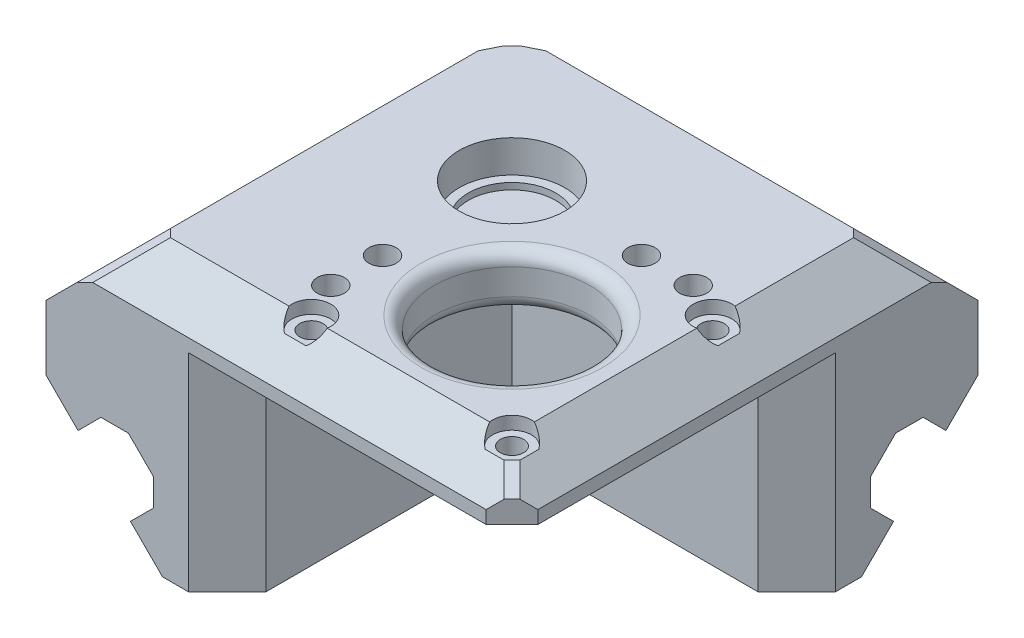
from build123d import *

# Parameters (mm, degrees)
SKETCH1_W           = 72
SKETCH1_H           = 72
SKETCH1_R           = 12
SKETCH1_R_2         = 1.8
BOSS_EXTRUDE1_DEPTH = 40
SKETCH6_W           = 44
SKETCH6_H           = 44
CUT_EXTRUDE1_DEPTH  = 32
CHAMFER1_SIZE       = 18
SKETCH7_W           = 18
SKETCH7_H           = 18
CUT_EXTRUDE2_DEPTH  = 65.745656225
CHAMFER2_SIZE       = 8
CHAMFER3_SIZE       = 4
SKETCH8_R           = 3
CUT_EXTRUDE3_DEPTH  = 2
CHAMFER5_SIZE       = 6
CHAMFER6_SIZE       = 6
CHAMFER7_SIZE       = 12
SKETCH9_R           = 2.1
CUT_EXTRUDE4_DEPTH  = 6
SKETCH10_R          = 2.1
CUT_EXTRUDE5_DEPTH  = 6
SKETCH11_R          = 8.15
CUT_EXTRUDE6_DEPTH  = 5
FILLET1_R           = 2
SKETCH13_R          = 6.75
CUT_EXTRUDE7_DEPTH  = 1
SKETCH15_R          = 2.1
CUT_EXTRUDE8_DEPTH  = 6
CHAMFER8_SIZE       = 1
SKETCH16_W          = 11.455844123
SKETCH16_H          = 76.568397014
CUT_EXTRUDE9_DEPTH  = 8
SKETCH17_W          = 86.001258557
SKETCH17_H          = 11.455844123
CUT_EXTRUDE10_DEPTH = 8
CHAMFER9_SIZE       = 3


with BuildPart() as part:
    # Sketch1 → Boss-Extrude1 (new body)
    with BuildSketch(Plane(origin=(0, 0, 0), x_dir=(1, 0, 0), z_dir=(0, 1, 0))):
        Rectangle(SKETCH1_W, SKETCH1_H)
        with Locations(Location((14, -14, 0), (0, 0, 270))):
            Circle(SKETCH1_R, mode=Mode.SUBTRACT)
        with Locations(Location((29.5, 1.5, 0), (0, 0, 270))):
            Circle(SKETCH1_R_2, mode=Mode.SUBTRACT)
        with Locations(Location((29.5, -29.5, 0), (0, 0, 270))):
            Circle(SKETCH1_R_2, mode=Mode.SUBTRACT)
        with Locations(Location((-1.5, -29.5, 0), (0, 0, 270))):
            Circle(SKETCH1_R_2, mode=Mode.SUBTRACT)
        with Locations(Location((-1.5, 1.5, 0), (0, 0, 270))):
            Circle(SKETCH1_R_2, mode=Mode.SUBTRACT)
    extrude(amount=BOSS_EXTRUDE1_DEPTH)

    # Sketch6 → Cut-Extrude1 (cut)
    with BuildSketch(Plane(origin=(0, 0, 0), x_dir=(-1, 0, 0), z_dir=(0, -1, 0))):
        with Locations((-14, -14)):
            Rectangle(SKETCH6_W, SKETCH6_H)
    extrude(amount=-CUT_EXTRUDE1_DEPTH, mode=Mode.SUBTRACT)

    # Chamfer1
    chamfer1_edges = [part.edges().sort_by_distance(p)[0] for p in [
        (-36, 0, 0),
        (0, 0, -36),
        (-36, 20, -36),
    ]]
    chamfer(chamfer1_edges, length=CHAMFER1_SIZE)

    # Sketch7 → Cut-Extrude2 (cut, through all)
    with BuildSketch(Plane(origin=(0, 40, 0), x_dir=(1, 0, 0), z_dir=(0, 1, 0))):
        with Locations((-27, 27)):
            Rectangle(SKETCH7_W, SKETCH7_H)
    extrude(amount=-CUT_EXTRUDE2_DEPTH, mode=Mode.SUBTRACT)

    # Chamfer2
    # the kernel refuses this chamfer: 8 mm, written as the material it adds along each edge
    with BuildSketch(Plane(origin=(-18, 40, -18), x_dir=(0.027495876610586487, 0, -0.9996219169112968), z_dir=(0, -1, 0))) as chamfer2_piece_1_section:
        Polygon((CHAMFER2_SIZE * 0.999621916911, -CHAMFER2_SIZE * 0.0274958766106), (-CHAMFER2_SIZE * 0.0274958766106, -CHAMFER2_SIZE * 0.999621916911), (0, 0), align=None)
    chamfer2_piece_1 = extrude(amount=60.573463904, mode=Mode.PRIVATE)
    chamfer2_piece_1 = split(chamfer2_piece_1, bisect_by=Plane(origin=(-20.597865647, 12.296786874, -30.296786874), z_dir=(0, 0.7071067811865476, 0.7071067811865476)), keep=Keep.TOP, mode=Mode.PRIVATE)
    chamfer2_piece_1 = split(chamfer2_piece_1, bisect_by=Plane(origin=(-30.296786874, 12.296786874, -20.597865647), z_dir=(0.7071067811865476, 0.7071067811865476, 0)), keep=Keep.TOP, mode=Mode.PRIVATE)
    add(chamfer2_piece_1)

    # Chamfer3
    chamfer3_edges = [part.edges().sort_by_distance(p)[0] for p in [
        (36, 36, 36),
    ]]
    chamfer(chamfer3_edges, length=CHAMFER3_SIZE)

    # Sketch8 → Cut-Extrude3 (cut)
    with BuildSketch(Plane(origin=(0, 40, 0), x_dir=(1, 0, 0), z_dir=(0, 1, 0))):
        with Locations(Location((-1.5, 1.5, 0), (0, 0, 270))):
            Circle(SKETCH8_R)
        with Locations(Location((29.5, 1.5, 0), (0, 0, 270))):
            Circle(SKETCH8_R)
        with Locations(Location((29.5, -29.5, 0), (0, 0, 270))):
            Circle(SKETCH8_R)
        with Locations(Location((-1.5, -29.5, 0), (0, 0, 270))):
            Circle(SKETCH8_R)
    extrude(amount=-CUT_EXTRUDE3_DEPTH, mode=Mode.SUBTRACT)

    # Chamfer5
    chamfer5_edges = [part.edges().sort_by_distance(p)[0] for p in [
        (36, 16, -8),
        (-8, 16, 36),
    ]]
    chamfer(chamfer5_edges, length=CHAMFER5_SIZE)

    # Chamfer6
    # the kernel refuses this chamfer: 6 mm, written as the material it takes off along each edge
    with BuildSketch(Plane(origin=(36, 40, -51.430097928), x_dir=(0.027495876610586768, -0.9996219169112968, 0), z_dir=(0, 0, 1)), Plane(origin=(47.430097928, 40, 36), x_dir=(0, -0.9996219169112965, 0.02749587661058676), z_dir=(-1, 0, 0))) as chamfer6_piece_1:
        Polygon((CHAMFER6_SIZE * 0.999621916911, -CHAMFER6_SIZE * 0.0274958766106), (-CHAMFER6_SIZE * 0.0274958766106, -CHAMFER6_SIZE * 0.999621916911), (0, 0), align=None)
    extrude(amount=98.860195856, mode=Mode.SUBTRACT)

    # Chamfer7
    chamfer7_edges = [part.edges().sort_by_distance(p)[0] for p in [
        (6, 40, -36),
        (-36, 40, 6),
    ]]
    chamfer(chamfer7_edges, length=CHAMFER7_SIZE)

    # Sketch9 → Cut-Extrude4 (cut)
    with BuildSketch(Plane(origin=(0, -9, -9), x_dir=(-1, 0, 0), z_dir=(0, -0.7071067811865488, -0.7071067811865464))):
        with Locations(Location((11.977430497, 15.455844123, 0), (0, 0, 90))):
            Circle(SKETCH9_R)
        with Locations(Location((-20.022569503, 15.455844123, 0), (0, 0, 90))):
            Circle(SKETCH9_R)
        with Locations(Location((-20.022569503, 35.455844123, 0), (0, 0, 90))):
            Circle(SKETCH9_R)
        with Locations(Location((11.977430497, 35.455844123, 0), (0, 0, 90))):
            Circle(SKETCH9_R)
    extrude(amount=-CUT_EXTRUDE4_DEPTH, mode=Mode.SUBTRACT)

    # Sketch10 → Cut-Extrude5 (cut)
    with BuildSketch(Plane(origin=(-9, -9, 0), x_dir=(-0.7071067811865488, 0.7071067811865464, 0), z_dir=(-0.7071067811865464, -0.7071067811865488, 0))):
        with Locations(Location((35.455844123, 12, 0), (0, 0, 180))):
            Circle(SKETCH10_R)
        with Locations(Location((35.455844123, -20, 0), (0, 0, 180))):
            Circle(SKETCH10_R)
        with Locations(Location((15.455844123, -20, 0), (0, 0, 180))):
            Circle(SKETCH10_R)
        with Locations(Location((15.455844123, 12, 0), (0, 0, 180))):
            Circle(SKETCH10_R)
    extrude(amount=-CUT_EXTRUDE5_DEPTH, mode=Mode.SUBTRACT)

    # Sketch11 → Cut-Extrude6 (cut)
    with BuildSketch(Plane(origin=(0, 40, 0), x_dir=(1, 0, 0), z_dir=(0, 1, 0))):
        with Locations(Location((-4, 4, 0), (0, 0, 270))):
            Circle(SKETCH11_R)
    extrude(amount=-CUT_EXTRUDE6_DEPTH, mode=Mode.SUBTRACT)

    # Fillet1
    fillet1_edges = [part.edges().sort_by_distance(p)[0] for p in [
        (14, 40, 2),
        (14, 32, 2),
    ]]
    fillet(fillet1_edges, radius=FILLET1_R)

    # Sketch13 → Cut-Extrude7 (cut)
    with BuildSketch(Plane(origin=(0, 35, 0), x_dir=(1, 0, 0), z_dir=(0, 1, 0))):
        with Locations(Location((-4, 4, 0), (0, 0, 270))):
            Circle(SKETCH13_R)
    extrude(amount=-CUT_EXTRUDE7_DEPTH, mode=Mode.SUBTRACT)

    # Sketch15 → Cut-Extrude8 (cut)
    with BuildSketch(Plane(origin=(0, 40, 0), x_dir=(1, 0, 0), z_dir=(0, 1, 0))):
        with Locations(Location((16, 4, 0), (0, 0, 270))):
            Circle(SKETCH15_R)
        with Locations(Location((24, 4, 0), (0, 0, 270))):
            Circle(SKETCH15_R)
        with Locations(Location((-4, -16, 0), (0, 0, 270))):
            Circle(SKETCH15_R)
        with Locations(Location((-4, -24, 0), (0, 0, 270))):
            Circle(SKETCH15_R)
    extrude(amount=-CUT_EXTRUDE8_DEPTH, mode=Mode.SUBTRACT)

    # Chamfer8
    chamfer8_edges = [part.edges().sort_by_distance(p)[0] for p in [
        (-25, 39, -19),
        (-19, 39, -25),
        (33, 37, -27),
        (32.810660172, 37.189339828, 32.810660172),
        (-27, 37, 33),
    ]]
    chamfer(chamfer8_edges, length=CHAMFER8_SIZE)

    # Sketch16 → Cut-Extrude9 (cut)
    with BuildSketch(Plane(origin=(-9, -9, 0), x_dir=(-0.7071067811865488, 0.7071067811865464, 0), z_dir=(-0.7071067811865464, -0.7071067811865488, 0))):
        with Locations((25.455844123, 2.284198507)):
            Rectangle(SKETCH16_W, SKETCH16_H)
    extrude(amount=-CUT_EXTRUDE9_DEPTH, mode=Mode.SUBTRACT)

    # Sketch17 → Cut-Extrude10 (cut)
    with BuildSketch(Plane(origin=(0, -9, -9), x_dir=(-1, 0, 0), z_dir=(0, -0.7071067811865488, -0.7071067811865464))):
        with Locations((7.000629278, 25.455844123)):
            Rectangle(SKETCH17_W, SKETCH17_H)
    extrude(amount=-CUT_EXTRUDE10_DEPTH, mode=Mode.SUBTRACT)

    # Chamfer9
    chamfer9_edges = [part.edges().sort_by_distance(p)[0] for p in [
        (8.696699141, 18.707106781, -25.393398282),
        (-25.393398282, 18.707106781, 8.696699141),
        (9.353553391, 10.606601718, -17.292893219),
        (-17.292893219, 10.606601718, 9.353553391),
    ]]
    chamfer(chamfer9_edges, length=CHAMFER9_SIZE)


solid = part.part
